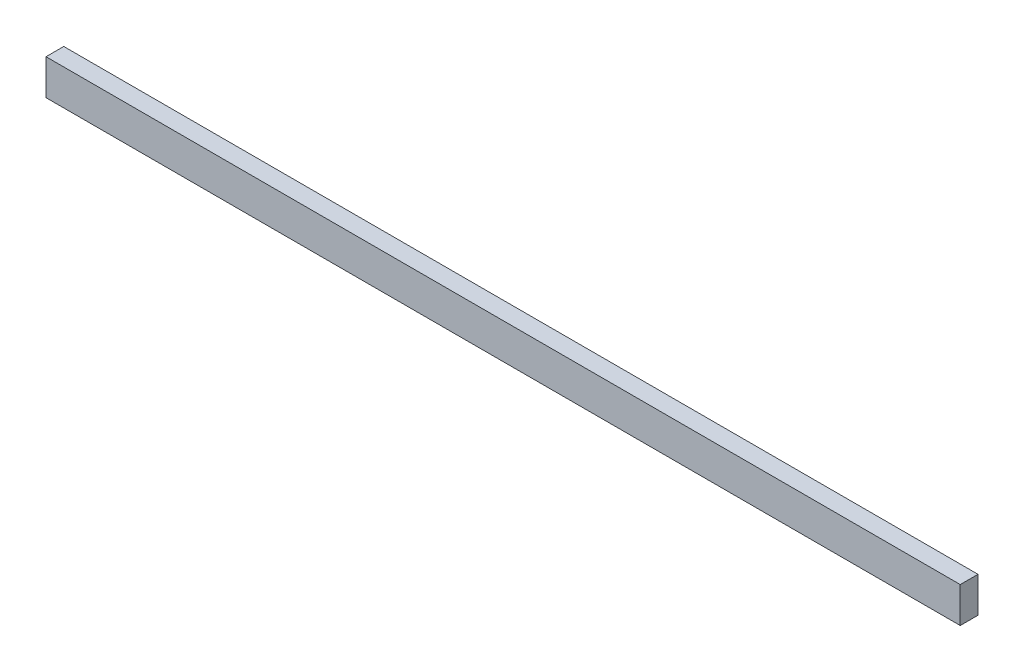
from build123d import *

# Parameters (mm, degrees)
SKETCH1_W           = 40
SKETCH1_H           = 80
BOSS_EXTRUDE1_DEPTH = 2060


with BuildPart() as part:
    # Sketch1 → Boss-Extrude1 (new body)
    with BuildSketch(Plane(origin=(0, 0, 0), x_dir=(0, 0, -1), z_dir=(1, 0, 0))):
        with Locations((20, 40)):
            Rectangle(SKETCH1_W, SKETCH1_H)
    extrude(amount=BOSS_EXTRUDE1_DEPTH)


solid = part.part
